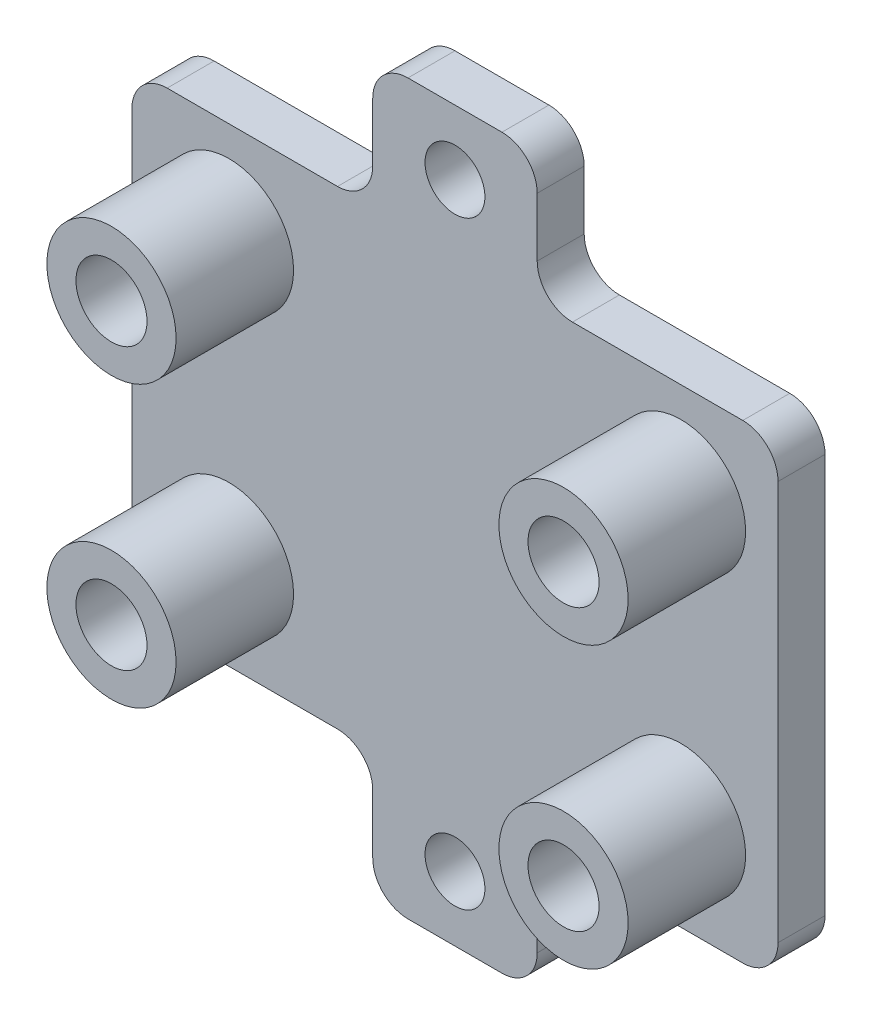
from build123d import *

# Parameters (mm, degrees)
SKETCH1_W           = 55
SKETCH1_H           = 40
BOSS_EXTRUDE1_DEPTH = 4
SKETCH3_R           = 5.5
SKETCH3_R_2         = 3.025
BOSS_EXTRUDE2_DEPTH = 10
SKETCH4_W           = 14
SKETCH4_H           = 11
SKETCH4_R           = 2.55
BOSS_EXTRUDE3_DEPTH = 4
FILLET2_R           = 3


with BuildPart() as part:
    # Sketch1 → Boss-Extrude1 (new body)
    with BuildSketch(Plane.XY):
        Rectangle(SKETCH1_W, SKETCH1_H)
    extrude(amount=BOSS_EXTRUDE1_DEPTH)

    # Sketch3 → Boss-Extrude2 (add)
    # profile 1 of 4: a face of its own
    with BuildSketch(Plane.XY.offset(4)):
        with Locations((-19.2405, 11.938)):
            Circle(SKETCH3_R)
        with Locations((-19.2405, 11.938)):
            Circle(SKETCH3_R_2, mode=Mode.SUBTRACT)
    # profile 2 of 4: a face of its own
    with BuildSketch(Plane.XY.offset(4)):
        with Locations((-19.2405, -11.938)):
            Circle(SKETCH3_R)
        with Locations((-19.2405, -11.938)):
            Circle(SKETCH3_R_2, mode=Mode.SUBTRACT)
    # profile 3 of 4: a face of its own
    with BuildSketch(Plane.XY.offset(4)):
        with Locations((19.2405, 11.938)):
            Circle(SKETCH3_R)
        with Locations((19.2405, 11.938)):
            Circle(SKETCH3_R_2, mode=Mode.SUBTRACT)
    # profile 4 of 4: a face of its own
    with BuildSketch(Plane.XY.offset(4)):
        with Locations((19.2405, -11.938)):
            Circle(SKETCH3_R)
        with Locations((19.2405, -11.938)):
            Circle(SKETCH3_R_2, mode=Mode.SUBTRACT)
    extrude(amount=BOSS_EXTRUDE2_DEPTH)

    # Sketch4 → Boss-Extrude3 (add)
    with BuildSketch(Plane.XY.offset(4)):
        with Locations((0, 25.5)):
            Rectangle(SKETCH4_W, SKETCH4_H)
        with Locations((0, 25.5)):
            Circle(SKETCH4_R, mode=Mode.SUBTRACT)
    boss_extrude3 = extrude(amount=-BOSS_EXTRUDE3_DEPTH)

    # Mirror2: Boss-Extrude3 across plane
    add(boss_extrude3.mirror(Plane.ZX))

    # Fillet2
    fillet2_edges = [part.edges().sort_by_distance(p)[0] for p in [
        (-27.5, 20, 2),
        (27.5, 20, 2),
        (-27.5, -20, 2),
        (27.5, -20, 2),
        (7, 31, 2),
        (-7, 31, 2),
        (-7, 20, 2),
        (7, 20, 2),
        (7, -31, 2),
        (-7, -31, 2),
        (-7, -20, 2),
        (7, -20, 2),
    ]]
    fillet(fillet2_edges, radius=FILLET2_R)


solid = part.part
